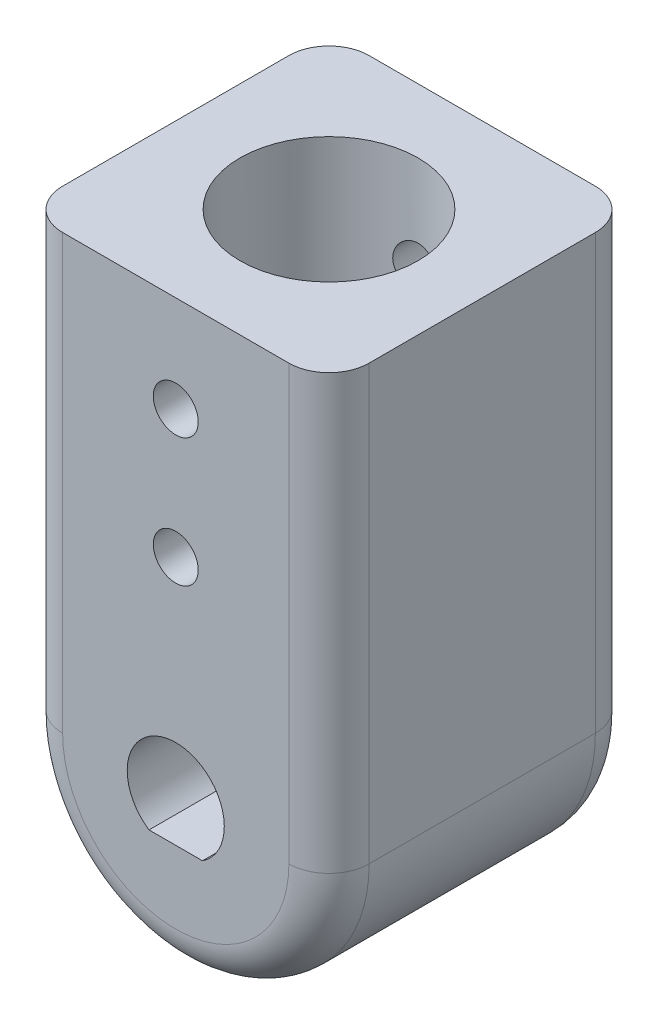
from build123d import *

# Parameters (mm, degrees)
SKETCH4_R                 = 9.55
BOSS_EXTRUDE1_DEPTH       = 9.55
BOSS_EXTRUDE2_START       = -9.55
BOSS_EXTRUDE2_DEPTH       = 19.1
BOSS_EXTRUDE2_START_2     = 7.771744082
BOSS_EXTRUDE2_2_OUTLINE_R = 5.55
BOSS_EXTRUDE2_2_DEPTH     = 19.253255918
BOSS_EXTRUDE2_START_3     = -7
BOSS_EXTRUDE2_3_DEPTH     = 14
CUT_EXTRUDE1_START        = 7.025
SKETCH7_R                 = 5.55
CUT_EXTRUDE1_DEPTH        = 20
CUT_EXTRUDE2_DEPTH        = 31.211845862
CUT_EXTRUDE2_DEPTH_BACK   = 31.211845862
SKETCH6_R                 = 1.4
FILLET1_R                 = 2.5


with BuildPart() as part:
    # Sketch4 → Boss-Extrude1 (new, symmetric)
    with BuildSketch(Plane.XY):
        Circle(SKETCH4_R)
        with BuildLine():
            Line((-1.665833125, -2.525), (1.665833125, -2.525))
            ThreePointArc((1.665833125, -2.525), (0, 3.025), (-1.665833125, -2.525))
        make_face(mode=Mode.SUBTRACT)
    extrude(amount=BOSS_EXTRUDE1_DEPTH, both=True)

    # Boss-Extrude2: read off the stored shape, not the designer's step
    # Boss-Extrude2 outline → Boss-Extrude2 (add)
    with BuildSketch(Plane.XY.offset(BOSS_EXTRUDE2_START)):
        with BuildLine():
            Line((9.55, 27.025), (-9.55, 27.025))
            Line((-9.55, 27.025), (-9.55, 0))
            ThreePointArc((-9.55, 0), (0, 9.55), (9.55, 0))
            Line((9.55, 0), (9.55, 27.025))
        make_face()
    extrude(amount=BOSS_EXTRUDE2_DEPTH)

    # Boss-Extrude2 2 outline → Boss-Extrude2 2 (cut)
    with BuildSketch(Plane(origin=(0, 0, 0), x_dir=(1, 0, 0), z_dir=(0, 1, 0)).offset(BOSS_EXTRUDE2_START_2)):
        Circle(BOSS_EXTRUDE2_2_OUTLINE_R)
    extrude(amount=BOSS_EXTRUDE2_2_DEPTH, mode=Mode.SUBTRACT)

    # Boss-Extrude2 3 outline → Boss-Extrude2 3 (add)
    with BuildSketch(Plane.XY.offset(BOSS_EXTRUDE2_START_3)):
        with BuildLine():
            ThreePointArc((5.549999815, 7.771743823), (0, 9.55), (-5.549999815, 7.771743823))
            Line((-5.549999815, 7.771743823), (5.549999815, 7.771743823))
        make_face()
    extrude(amount=BOSS_EXTRUDE2_3_DEPTH)

    # Sketch7 → Cut-Extrude1 (cut)
    with BuildSketch(Plane(origin=(0, 0, 0), x_dir=(1, 0, 0), z_dir=(0, 1, 0)).offset(CUT_EXTRUDE1_START)):
        with Locations(Location((0, 0, 0), (0, 0, 90))):
            Circle(SKETCH7_R)
    extrude(amount=CUT_EXTRUDE1_DEPTH, mode=Mode.SUBTRACT)

    # Sketch6 → Cut-Extrude2 (cut, two sides: drawn at the far end of the back side and taken through both)
    with BuildSketch(Plane.XY.offset(-CUT_EXTRUDE2_DEPTH_BACK)):
        with Locations((0, 21.025)):
            Circle(SKETCH6_R)
        with Locations((0, 13.025)):
            Circle(SKETCH6_R)
    extrude(amount=CUT_EXTRUDE2_DEPTH + CUT_EXTRUDE2_DEPTH_BACK, mode=Mode.SUBTRACT)

    # Fillet1
    fillet1_edges = [part.edges().sort_by_distance(p)[0] for p in [
        (0, -9.55, 9.55),
        (0, -9.55, -9.55),
        (-9.55, 13.5125, -9.55),
        (-9.55, 13.5125, 9.55),
        (9.55, 13.5125, 9.55),
        (9.55, 13.5125, -9.55),
    ]]
    fillet(fillet1_edges, radius=FILLET1_R)


solid = part.part
